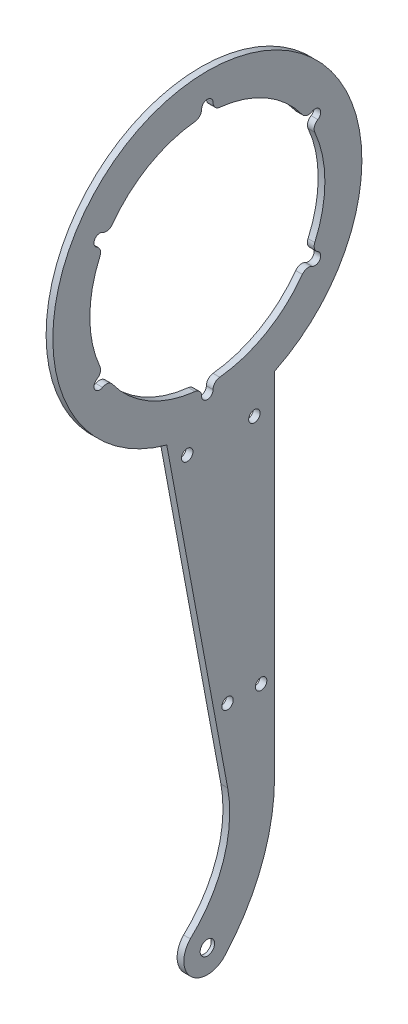
from build123d import *

# Parameters (mm, degrees)
SKETCH_1_R          = 2.15
SKETCH_1_R_2        = 1.7
EXTRUDE_3_DEPTH     = 2
SKETCH_2_R          = 5
CUT_EXTRUDE_1_DEPTH = 1


with BuildPart() as part:
    # 草图1 → 凸台-拉伸3 (new body)
    with BuildSketch(Plane(origin=(0, 0, 0), x_dir=(0, 0, -1), z_dir=(1, 0, 0))):
        with BuildLine():
            Line((-12.086651446, -44.383700351), (6.041480072, -141.833924558))
            ThreePointArc((6.041480072, -141.833924558), (4.790925001, -159.943403755), (-5.076247296, -175.180071226))
            ThreePointArc((-5.076247296, -175.180071226), (-4.750224064, -185.141533949), (5.205863532, -184.679635124))
            ThreePointArc((5.205863532, -184.679635124), (16.174710493, -166.755300274), (20, -146.092179898))
            Line((20, -146.092179898), (20, -41.424630354))
            ThreePointArc((20, -41.424630354), (-4.224250838, 45.80562962), (-12.086651446, -44.383700351))
        make_face()
        with Locations((0, -180)):
            Circle(SKETCH_1_R, mode=Mode.SUBTRACT)
        with Locations((-6, -50)):
            Circle(SKETCH_1_R_2, mode=Mode.SUBTRACT)
        with Locations((14, -50)):
            Circle(SKETCH_1_R_2, mode=Mode.SUBTRACT)
        with Locations((6, -120)):
            Circle(SKETCH_1_R_2, mode=Mode.SUBTRACT)
        with Locations((16, -120)):
            Circle(SKETCH_1_R_2, mode=Mode.SUBTRACT)
        with BuildLine():
            ThreePointArc((1.7, -37), (2.270210089, -35.513550931), (3.688261329, -34.789809912))
            ThreePointArc((3.688261329, -34.789809912), (17.492385095, -30.297699731), (28.284728512, -20.589032962))
            ThreePointArc((28.284728512, -20.589032962), (29.62053224, -19.722835075), (31.19293994, -19.972243186))
            ThreePointArc((31.19293994, -19.972243186), (33.515183126, -19.35), (32.89293994, -17.027756814))
            ThreePointArc((32.89293994, -17.027756814), (31.89074233, -15.790715856), (31.972989841, -14.200776949))
            ThreePointArc((31.972989841, -14.200776949), (34.984770191, 0), (31.972989841, 14.200776949))
            ThreePointArc((31.972989841, 14.200776949), (31.89074233, 15.790715856), (32.89293994, 17.027756814))
            ThreePointArc((32.89293994, 17.027756814), (33.515183126, 19.35), (31.19293994, 19.972243186))
            ThreePointArc((31.19293994, 19.972243186), (29.62053224, 19.722835075), (28.284728512, 20.589032962))
            ThreePointArc((28.284728512, 20.589032962), (17.492385095, 30.297699731), (3.688261329, 34.789809912))
            ThreePointArc((3.688261329, 34.789809912), (2.270210089, 35.513550931), (1.7, 37))
            ThreePointArc((1.7, 37), (0, 38.7), (-1.7, 37))
            ThreePointArc((-1.7, 37), (-2.270210089, 35.513550931), (-3.688261329, 34.789809912))
            ThreePointArc((-3.688261329, 34.789809912), (-17.492385095, 30.297699731), (-28.284728512, 20.589032962))
            ThreePointArc((-28.284728512, 20.589032962), (-29.62053224, 19.722835075), (-31.19293994, 19.972243186))
            ThreePointArc((-31.19293994, 19.972243186), (-33.515183126, 19.35), (-32.89293994, 17.027756814))
            ThreePointArc((-32.89293994, 17.027756814), (-31.89074233, 15.790715856), (-31.972989841, 14.200776949))
            ThreePointArc((-31.972989841, 14.200776949), (-34.984770191, 0), (-31.972989841, -14.200776949))
            ThreePointArc((-31.972989841, -14.200776949), (-31.89074233, -15.790715856), (-32.89293994, -17.027756814))
            ThreePointArc((-32.89293994, -17.027756814), (-33.515183126, -19.35), (-31.19293994, -19.972243186))
            ThreePointArc((-31.19293994, -19.972243186), (-29.62053224, -19.722835075), (-28.284728512, -20.589032962))
            ThreePointArc((-28.284728512, -20.589032962), (-17.492385095, -30.297699731), (-3.688261329, -34.789809912))
            ThreePointArc((-3.688261329, -34.789809912), (-2.270210089, -35.513550931), (-1.7, -37))
            ThreePointArc((-1.7, -37), (0, -38.7), (1.7, -37))
        make_face(mode=Mode.SUBTRACT)
    extrude(amount=EXTRUDE_3_DEPTH)

    # 草图2 → 切除-拉伸1 (cut)
    with BuildSketch(Plane.ZY):
        with Locations((0, -180)):
            Circle(SKETCH_2_R)
    extrude(amount=-CUT_EXTRUDE_1_DEPTH, mode=Mode.SUBTRACT)


solid = part.part
